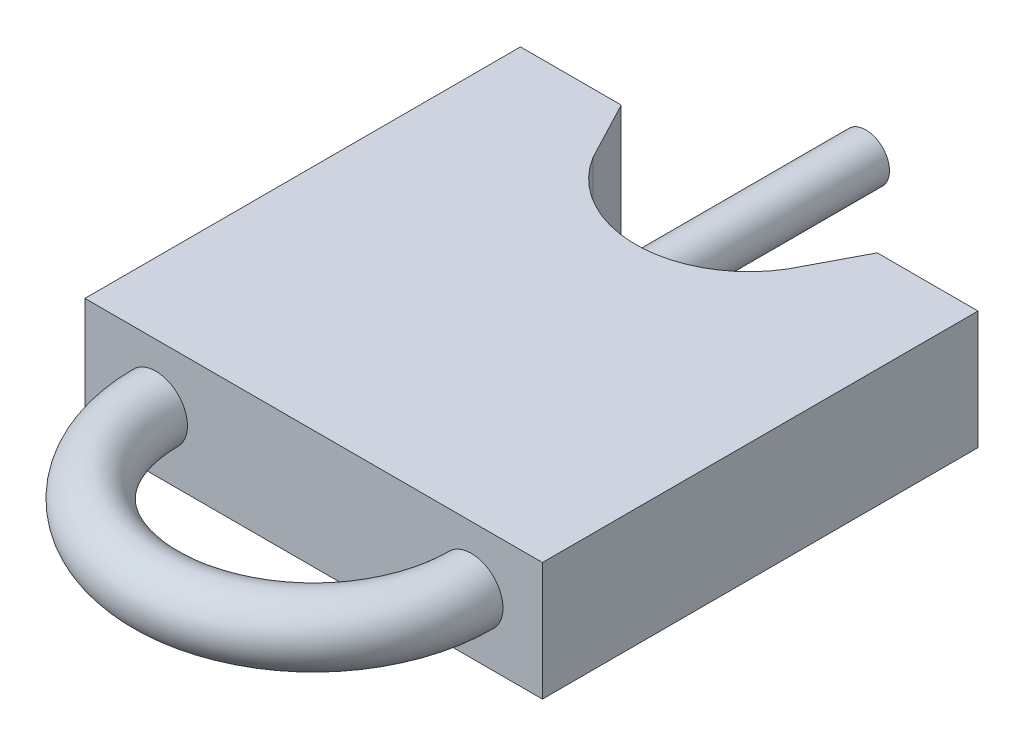
from build123d import *

# Parameters (mm, degrees)
SKETCH1_R           = 1.5
BOSS_EXTRUDE1_DEPTH = 20
BOSS_EXTRUDE2_START = 15
BOSS_EXTRUDE2_DEPTH = 15
SWEEP1_PROFILE_R    = 2
BOSS_EXTRUDE3_DEPTH = 7.5
CHAMFER1_START      = -6
CHAMFER1_DEPTH      = 9
CHAMFER1_START_2    = -5
CHAMFER1_2_DEPTH    = 7.5


with BuildPart() as part:
    # Sketch1 → Boss-Extrude1 (new body)
    with BuildSketch(Plane.XY):
        Circle(SKETCH1_R)
    extrude(amount=-BOSS_EXTRUDE1_DEPTH)

    # Sketch1<3> → Boss-Extrude2 (add)
    with BuildSketch(Plane.XY.offset(BOSS_EXTRUDE2_START)):
        with BuildLine():
            Line((0, 1.5), (0, 2.5))
            Line((0, 2.5), (-14.5, 2.5))
            Line((-14.5, 2.5), (-14.5, -5))
            Line((-14.5, -5), (0, -5))
            Line((0, -5), (0, -1.5))
            ThreePointArc((0, -1.5), (-1.5, 0), (0, 1.5))
        make_face()
        with BuildLine():
            ThreePointArc((1.5, 0), (1.060660172, 1.060660172), (0, 1.5))
            Line((0, 1.5), (0, -1.5))
            ThreePointArc((0, -1.5), (1.060660172, -1.060660172), (1.5, 0))
        make_face()
        with BuildLine():
            Line((0, -1.5), (0, 1.5))
            ThreePointArc((0, 1.5), (-1.5, 0), (0, -1.5))
        make_face()
        with BuildLine():
            Line((14.5, 2.5), (0, 2.5))
            Line((0, 2.5), (0, 1.5))
            ThreePointArc((0, 1.5), (1.060660172, 1.060660172), (1.5, 0))
            ThreePointArc((1.5, 0), (1.060660172, -1.060660172), (0, -1.5))
            Line((0, -1.5), (0, -5))
            Line((0, -5), (14.5, -5))
            Line((14.5, -5), (14.5, 2.5))
        make_face()
    extrude(amount=-BOSS_EXTRUDE2_DEPTH)

    # Sweep1: sweep along a path in Sketch2
    with BuildLine(Plane(origin=(0, -1.25, 0), x_dir=(1, 0, 0), z_dir=(0, 1, 0))) as sweep1_path:
        ThreePointArc((-10, -15), (0, -25), (10, -15))
    # Sweep1 profile (on start of the path) → Sweep1 (sweep)
    with BuildSketch(Plane(origin=(-10, -1.25, 15), x_dir=(1, 0, 0), z_dir=(0, 0, 1))):
        Circle(SWEEP1_PROFILE_R)
    sweep(path=sweep1_path.line)

    # Sketch15 → Boss-Extrude3 (add)
    with BuildSketch(Plane(origin=(0, 2.5, 0), x_dir=(1, 0, 0), z_dir=(0, 1, 0))):
        with BuildLine():
            ThreePointArc((-7.2, 12.61), (0, 5.41), (7.2, 12.61))
            Line((7.2, 12.61), (14.5, 12.61))
            Line((14.5, 12.61), (14.5, 0))
            Line((14.5, 0), (-14.5, 0))
            Line((-14.5, 0), (-14.5, 12.61))
            Line((-14.5, 12.61), (-7.2, 12.61))
        make_face()
    extrude(amount=-BOSS_EXTRUDE3_DEPTH)

    # Chamfer1: read off the stored shape, not the designer's step
    # Chamfer1 outline → Chamfer1 (cut)
    with BuildSketch(Plane(origin=(0, 0, 0), x_dir=(1, 0, 0), z_dir=(0, 1, 0)).offset(CHAMFER1_START)):
        with BuildLine():
            ThreePointArc((7.2, 12.61), (7.04514475, 11.12476081), (6.587240153, 9.7034097))
            Line((6.587240153, 9.7034097), (8.114814982, 12.61))
            Line((8.114814982, 12.61), (7.2, 12.61))
        make_face()
        with BuildLine():
            Line((-8.114814982, 12.61), (-6.587240153, 9.7034097))
            ThreePointArc((-6.587240153, 9.7034097), (-7.04514475, 11.12476081), (-7.2, 12.61))
            Line((-7.2, 12.61), (-8.114814982, 12.61))
        make_face()
    extrude(amount=CHAMFER1_DEPTH, mode=Mode.SUBTRACT)

    # Chamfer1 2 outline → Chamfer1 2 (add)
    with BuildSketch(Plane(origin=(0, 0, 0), x_dir=(1, 0, 0), z_dir=(0, 1, 0)).offset(CHAMFER1_START_2)):
        with BuildLine():
            ThreePointArc((-6.587240153, 9.7034097), (-6.373406906, 9.260420263), (-6.129825647, 8.83306506))
            Line((-6.129825647, 8.83306506), (-6.587240153, 9.7034097))
        make_face()
        with BuildLine():
            Line((6.587240153, 9.7034097), (6.129825647, 8.83306506))
            ThreePointArc((6.129825647, 8.83306506), (6.373406906, 9.260420263), (6.587240153, 9.7034097))
        make_face()
    extrude(amount=CHAMFER1_2_DEPTH)


solid = part.part
